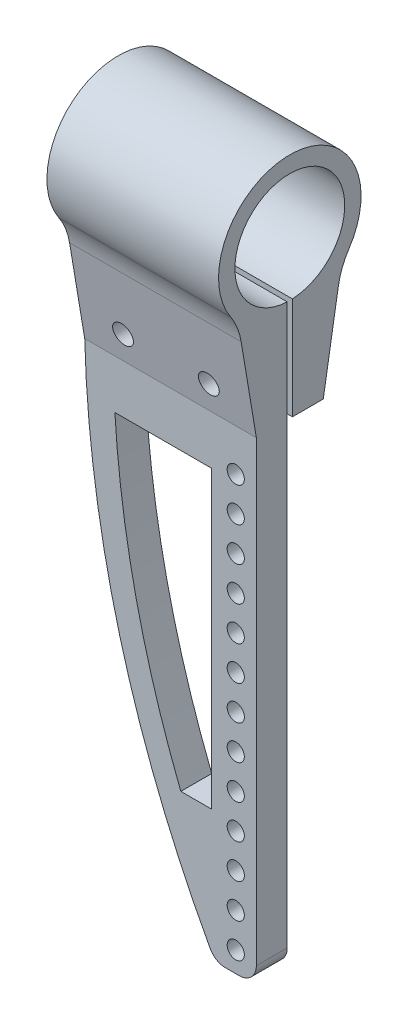
from build123d import *

# Parameters (mm, degrees)
RESSALTO_EXTRUS_O1_DEPTH = 25
ESPELHAR1_START          = -25
ESPELHAR1_DEPTH          = 50
ESBO_O10_R               = 3
CORTE_EXTRUS_O6_DEPTH    = 44.5
RESSALTO_EXTRUS_O2_START = 0.75
RESSALTO_EXTRUS_O2_DEPTH = 9
ESBO_O12_R               = 2.5
CORTE_EXTRUS_O7_DEPTH    = 189.180392443
PADR_O_LINEAR1_COUNT     = 13
PADR_O_LINEAR1_PITCH     = 10
CORTE_EXTRUS_O8_DEPTH    = 189.180392443
FILETE1_R                = 5


# Read off the part's stored shape, not the designer's step: Espelhar1
with BuildPart() as part:
    # Esboço2 → Ressalto-extrusão1 (new, symmetric)
    with BuildSketch(Plane(origin=(0, 0, 0), x_dir=(0, 0, -1), z_dir=(1, 0, 0))):
        with BuildLine():
            Line((14.172351725, -19.333068153), (9.75, -45.76))
            Line((9.75, -45.76), (0.75, -45.76))
            Line((0.75, -45.76), (0.75, -15.982412208))
            ThreePointArc((0.75, -15.982412208), (15.995602448, 0.375103096), (0, 16))
            Line((0, 16), (0, 20.76))
            ThreePointArc((0, 20.76), (18.307093974, 9.789173112), (17.265058969, -11.528024063))
            ThreePointArc((17.265058969, -11.528024063), (15.304550089, -15.266439288), (14.172351725, -19.333068153))
        make_face()
    extrude(amount=RESSALTO_EXTRUS_O1_DEPTH, both=True)

    # Espelhar1 outline → Espelhar1 (add)
    with BuildSketch(Plane.YZ.offset(ESPELHAR1_START)):
        with BuildLine():
            Line((-19.333068153, 14.172351725), (-45.76, 9.75))
            Line((-45.76, 9.75), (-45.76, 0.75))
            Line((-45.76, 0.75), (-15.982412208, 0.75))
            ThreePointArc((-15.982412208, 0.75), (0.375103096, 15.995602448), (16, 0))
            Line((16, 0), (20.76, 0))
            ThreePointArc((20.76, 0), (9.789173112, 18.307093974), (-11.528024063, 17.265058969))
            ThreePointArc((-11.528024063, 17.265058969), (-15.266439288, 15.304550089), (-19.333068153, 14.172351725))
        make_face()
    extrude(amount=ESPELHAR1_DEPTH)

    # Esboço10 → Corte-extrusão6 (cut, symmetric)
    with BuildSketch(Plane.XY):
        with Locations(Location((-12.5, -37.76, 0), (0, 0, 90))):
            Circle(ESBO_O10_R)
        with Locations(Location((12.5, -37.76, 0), (0, 0, 90))):
            Circle(ESBO_O10_R)
    extrude(amount=CORTE_EXTRUS_O6_DEPTH, both=True, mode=Mode.SUBTRACT)

    # Esboço11 → Ressalto-extrusão2 (add)
    with BuildSketch(Plane.XY.offset(RESSALTO_EXTRUS_O2_START)):
        with BuildLine():
            Line((-25, -45.76), (25, -45.76))
            Line((25, -45.76), (25, -184))
            Line((25, -184), (13, -184))
            ThreePointArc((13, -184), (-14.37934254, -117.183349367), (-25, -45.76))
        make_face()
    extrude(amount=RESSALTO_EXTRUS_O2_DEPTH)

    # Esboço12 → Corte-extrusão7 (cut, through all)
    with BuildSketch(Plane.XY.offset(9.75)):
        with Locations((19, -178)):
            Circle(ESBO_O12_R)
    corte_extrus_o7 = extrude(amount=-CORTE_EXTRUS_O7_DEPTH, mode=Mode.SUBTRACT)

    # Padrão linear1: Corte-extrusão7 ×13
    with Locations(*[(0, i * PADR_O_LINEAR1_PITCH, 0) for i in range(1, PADR_O_LINEAR1_COUNT)]):
        add(corte_extrus_o7, mode=Mode.SUBTRACT)

    # Esboço13 → Corte-extrusão8 (cut, through all)
    with BuildSketch(Plane.XY.offset(9.75)):
        with BuildLine():
            Line((-16.219640416, -60), (12, -60))
            Line((12, -60), (12, -146))
            Line((12, -146), (3, -146))
            ThreePointArc((3, -146), (-10.033576546, -103.765155415), (-16.219640416, -60))
        make_face()
    extrude(amount=-CORTE_EXTRUS_O8_DEPTH, mode=Mode.SUBTRACT)

    # Filete1
    filete1_edges = [part.edges().sort_by_distance(p)[0] for p in [
        (13, -184, 5.25),
        (25, -184, 5.25),
    ]]
    fillet(filete1_edges, radius=FILETE1_R)


solid = part.part
